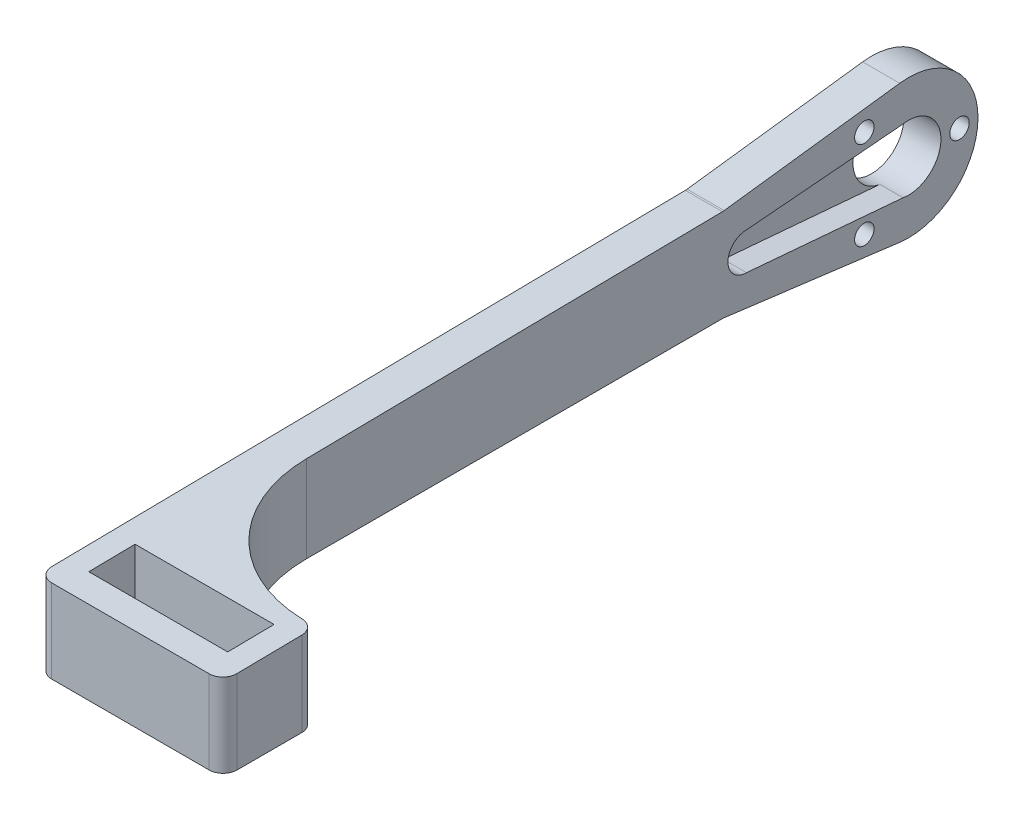
from build123d import *

# Parameters (mm, degrees)
BOSS_EXTRU_1_DEPTH           = 4
ESQUISSE2_R                  = 3.5
ENL_V_MAT_EXTRU_1_DEPTH      = 10
ENL_V_MAT_EXTRU_2_DEPTH      = 2.5
ESQUISSE5_R                  = 1.05
ENL_V_MAT_EXTRU_3_DEPTH      = 59.124865591
ESQUISSE6_W                  = 20
ESQUISSE6_H                  = 10
BOSS_EXTRU_2_DEPTH           = 10
ESQUISSE7_W                  = 15
ESQUISSE7_H                  = 5
ENL_V_MAT_EXTRU_4_DEPTH      = 10
CONG_2_R                     = 1.5
CONG_3_R                     = 15
ENL_V_MAT_EXTRU_5_DEPTH      = 62.339220871
ENL_V_MAT_EXTRU_5_DEPTH_BACK = 62.339220871


with BuildPart() as part:
    # Esquisse1 → Boss.-Extru.1 (new body)
    with BuildSketch(Plane(origin=(0, 0, 0), x_dir=(0, 0, -1), z_dir=(1, 0, 0))):
        with BuildLine():
            Line((30, 5), (-30, 5))
            Line((-30, 5), (-30, -5))
            Line((-30, -5), (30, -5))
            Line((30, -5), (49.047311562, -7.439246248))
            ThreePointArc((49.047311562, -7.439246248), (57.484796152, -0.477311816), (50, 7.5))
            ThreePointArc((50, 7.5), (49.522688184, 7.484796152), (49.047311562, 7.439246248))
            Line((49.047311562, 7.439246248), (30, 5))
        make_face()
    extrude(amount=BOSS_EXTRU_1_DEPTH)

    # Esquisse2 → Enlèv. mat.-Extru.1 (cut)
    with BuildSketch(Plane(origin=(4, 0, 0), x_dir=(0, 0, -1), z_dir=(1, 0, 0))):
        with Locations((50, 0)):
            Circle(ESQUISSE2_R)
    extrude(amount=-ENL_V_MAT_EXTRU_1_DEPTH, mode=Mode.SUBTRACT)

    # Esquisse3 → Enlèv. mat.-Extru.2 (cut)
    with BuildSketch(Plane(origin=(4, 0, 0), x_dir=(0, 0, -1), z_dir=(1, 0, 0))):
        with BuildLine():
            Line((49.404376013, 3.448946515), (32.5, 2))
            ThreePointArc((32.5, 2), (30.5, 0), (32.5, -2))
            Line((32.5, -2), (49.404376013, -3.448946515))
            ThreePointArc((49.404376013, -3.448946515), (46.5, 0), (49.404376013, 3.448946515))
        make_face()
    extrude(amount=-ENL_V_MAT_EXTRU_2_DEPTH, mode=Mode.SUBTRACT)

    # Esquisse5 → Enlèv. mat.-Extru.3 (cut, through all)
    with BuildSketch(Plane(origin=(4, 0, 0), x_dir=(0, 0, -1), z_dir=(1, 0, 0))):
        with Locations((55.5, 0)):
            Circle(ESQUISSE5_R)
        with Locations((45.227029227, 4.772970773)):
            Circle(ESQUISSE5_R)
        with Locations((45.227029227, -4.772970773)):
            Circle(ESQUISSE5_R)
    extrude(amount=-ENL_V_MAT_EXTRU_3_DEPTH, mode=Mode.SUBTRACT)

    # Esquisse6 → Boss.-Extru.2 (add)
    with BuildSketch(Plane.XY.offset(30)):
        with Locations((10, 0)):
            Rectangle(ESQUISSE6_W, ESQUISSE6_H)
    extrude(amount=BOSS_EXTRU_2_DEPTH)

    # Esquisse7 → Enlèv. mat.-Extru.4 (cut)
    with BuildSketch(Plane(origin=(0, 5, 0), x_dir=(1, 0, 0), z_dir=(0, 1, 0))):
        with Locations((10, -34.5)):
            Rectangle(ESQUISSE7_W, ESQUISSE7_H)
    extrude(amount=-ENL_V_MAT_EXTRU_4_DEPTH, mode=Mode.SUBTRACT)

    # Congé2
    cong_2_edges = [part.edges().sort_by_distance(p)[0] for p in [
        (2, 5, -30),
        (2, -5, -30),
        (20, 0, 30),
        (20, 0, 40),
        (0, 0, 40),
    ]]
    fillet(cong_2_edges, radius=CONG_2_R)

    # Congé3
    cong_3_edges = [part.edges().sort_by_distance(p)[0] for p in [
        (4, 0, 30),
    ]]
    fillet(cong_3_edges, radius=CONG_3_R)

    # Esquisse8 → Enlèv. mat.-Extru.5 (cut, two sides: drawn at the far end of the back side and taken through both)
    with BuildSketch(Plane(origin=(20, 0, 0), x_dir=(0, 0, -1), z_dir=(1, 0, 0)).offset(-ENL_V_MAT_EXTRU_5_DEPTH_BACK)):
        Polygon((-40, 5), (-40, 4), (29.904343724, 5), align=None)
    extrude(amount=ENL_V_MAT_EXTRU_5_DEPTH + ENL_V_MAT_EXTRU_5_DEPTH_BACK, mode=Mode.SUBTRACT)


solid = part.part
